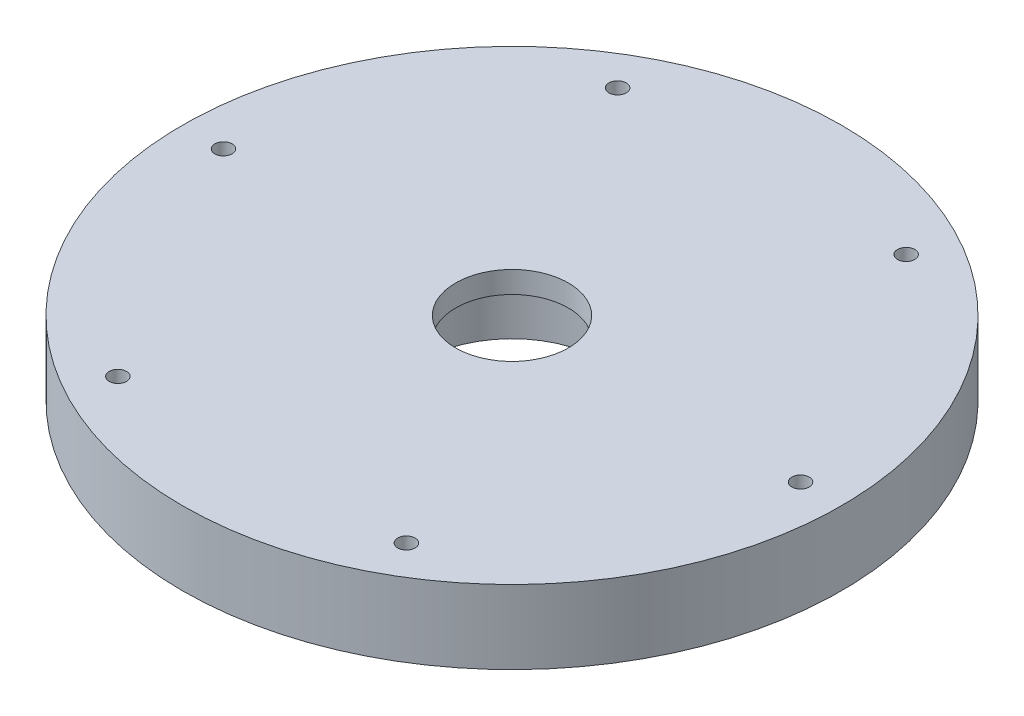
from build123d import *

# Parameters (mm, degrees)
SKETCH2_R          = 1
CUT_EXTRUDE1_DEPTH = 55.617419382


with BuildPart() as part:
    # Sketch1 → Revolve1 (revolve)
    with BuildSketch(Plane.XY):
        Polygon((-6.5, 0), (-38, 0), (-38, -8.5), (-35, -8.5), (-35, -9.75), (-10.5, -9.75), (-10.5, -2.5), (-6.5, -2.5), align=None)
    revolve(axis=Axis((0, 38.708668819, 0), (0, -1, 0)))

    # Sketch2 → Cut-Extrude1 (cut, through all)
    with BuildSketch(Plane.XZ.offset(9.75)):
        with Locations((-33.26875, 0)):
            Circle(SKETCH2_R)
        with Locations((-16.634375, 28.811582652)):
            Circle(SKETCH2_R)
        with Locations((16.634375, 28.811582652)):
            Circle(SKETCH2_R)
        with Locations((33.26875, 0)):
            Circle(SKETCH2_R)
        with Locations((16.634375, -28.811582652)):
            Circle(SKETCH2_R)
        with Locations((-16.634375, -28.811582652)):
            Circle(SKETCH2_R)
    extrude(amount=-CUT_EXTRUDE1_DEPTH, mode=Mode.SUBTRACT)


solid = part.part
